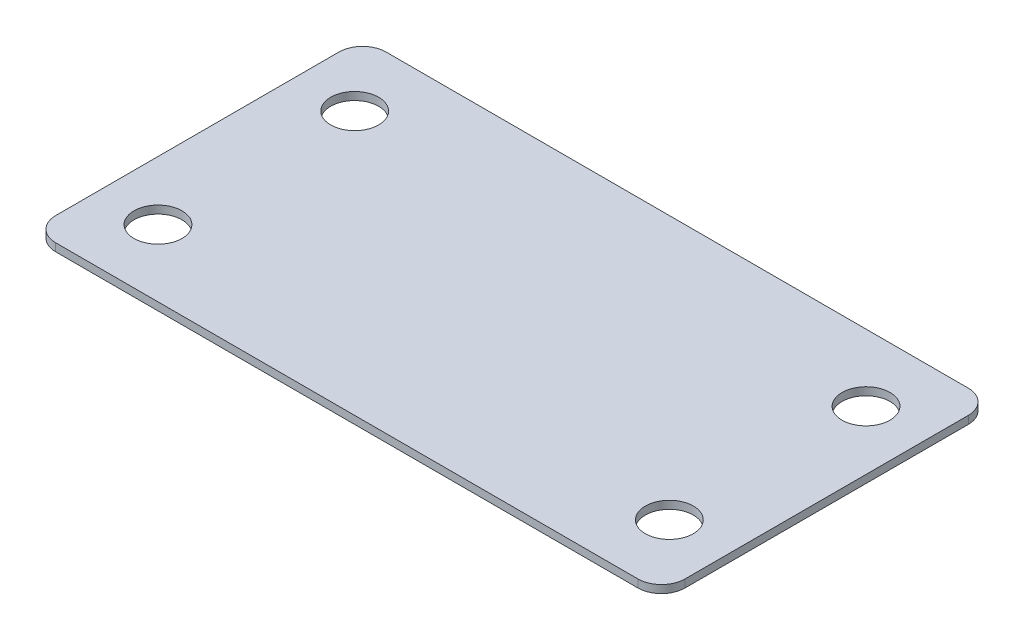
from build123d import *

# Parameters (mm, degrees)
SKETCH_1_W              = 80
SKETCH_1_H              = 42
SM_BASE_FLANGE_1_DEPTH  = 1
FILLET_1_R              = 3
HOLE_WIZARD_6_2_6_2_1_D = 6.1


# Sheet-metal steps are written as plain solids
with BuildPart() as part:
    # Sketch 1 → Базовая кромка1 (new body)
    with BuildSketch(Plane(origin=(0, 0, 0), x_dir=(1, 0, 0), z_dir=(0, 1, 0))):
        Rectangle(SKETCH_1_W, SKETCH_1_H)
    extrude(amount=-SM_BASE_FLANGE_1_DEPTH)

    # Скругление1
    fillet_1_edges = [part.edges().sort_by_distance(p)[0] for p in [
        (40, -0.5, 21),
        (-40, -0.5, 21),
        (-40, -0.5, -21),
        (40, -0.5, -21),
    ]]
    fillet(fillet_1_edges, radius=FILLET_1_R)

    # Диаметр отверстия Ø6.2 (6.2)1 (through all)
    with Locations(Plane(origin=(0, 0, 0), x_dir=(1, 0, 0), z_dir=(0, 1, 0))):
        with Locations((-32.5, 12.5), (-32.5, -12.5), (32.5, -12.5), (32.5, 12.5)):
            Hole(HOLE_WIZARD_6_2_6_2_1_D / 2)


solid = part.part
